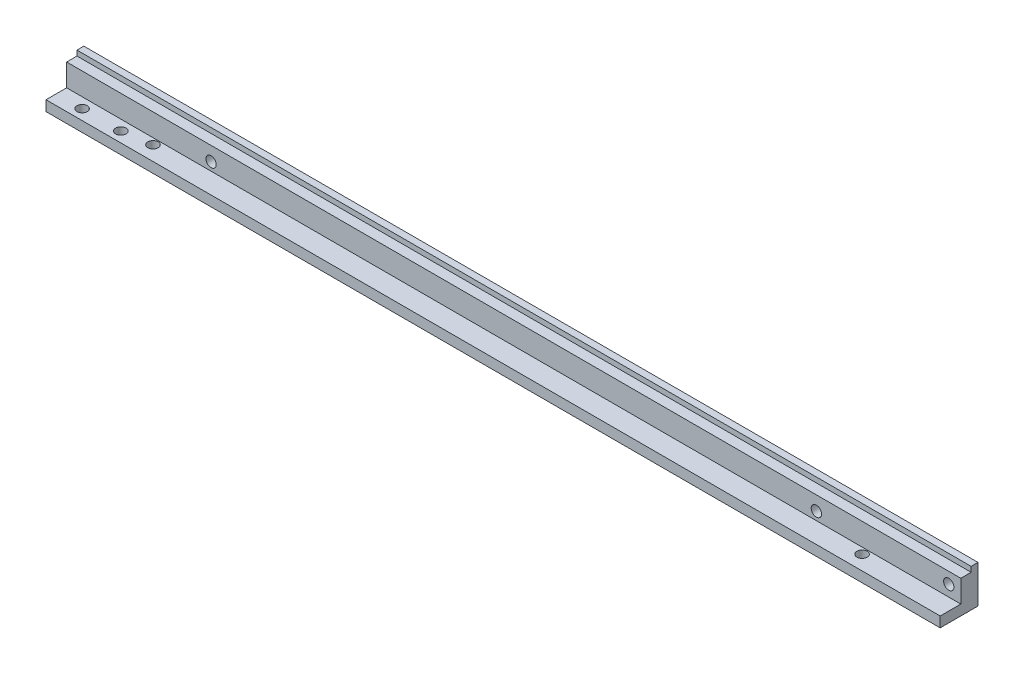
from build123d import *

# Parameters (mm, degrees)
EXTRUDE_1_DEPTH     = 260
SKETCH_2_R          = 1.5
CUT_EXTRUDE_1_DEPTH = 261.301747977
SKETCH_3_R          = 1.5
CUT_EXTRUDE_2_DEPTH = 261.355526156
SKETCH_4_R          = 1.5
CUT_EXTRUDE_3_DEPTH = 261.301747977
SKETCH_5_R          = 1.5
CUT_EXTRUDE_4_DEPTH = 261.355526156


with BuildPart() as part:
    # Эскиз1 → Бобышка-Вытянуть1 (new body)
    with BuildSketch(Plane(origin=(0, 0, 0), x_dir=(0, 0, -1), z_dir=(1, 0, 0))):
        Polygon((0, 0), (-11, 0), (-11, 3), (-5, 3), (-5, 9.5), (-2, 9.5), (-2, 11), (0, 11), align=None)
    extrude(amount=EXTRUDE_1_DEPTH)

    # Эскиз2 → Вырез-Вытянуть1 (cut, through all)
    with BuildSketch(Plane.XY.offset(5)):
        with Locations((256.5, 6.25)):
            Circle(SKETCH_2_R)
    extrude(amount=-CUT_EXTRUDE_1_DEPTH, mode=Mode.SUBTRACT)

    # Эскиз3 → Вырез-Вытянуть2 (cut, through all)
    with BuildSketch(Plane(origin=(0, 3, 0), x_dir=(1, 0, 0), z_dir=(0, 1, 0))):
        with Locations((7.5, -8)):
            Circle(SKETCH_3_R)
        with Locations((18.75, -8)):
            Circle(SKETCH_3_R)
    extrude(amount=-CUT_EXTRUDE_2_DEPTH, mode=Mode.SUBTRACT)

    # Эскиз4 → Вырез-Вытянуть3 (cut, through all)
    with BuildSketch(Plane.XY.offset(5)):
        with Locations((42, 5.4)):
            Circle(SKETCH_4_R)
        with Locations((218, 5.4)):
            Circle(SKETCH_4_R)
    extrude(amount=-CUT_EXTRUDE_3_DEPTH, mode=Mode.SUBTRACT)

    # Эскиз5 → Вырез-Вытянуть4 (cut, through all)
    with BuildSketch(Plane(origin=(0, 3, 0), x_dir=(1, 0, 0), z_dir=(0, 1, 0))):
        with Locations((26.91, -6.8)):
            Circle(SKETCH_5_R)
        with Locations((233.09, -6.8)):
            Circle(SKETCH_5_R)
    extrude(amount=-CUT_EXTRUDE_4_DEPTH, mode=Mode.SUBTRACT)


solid = part.part
